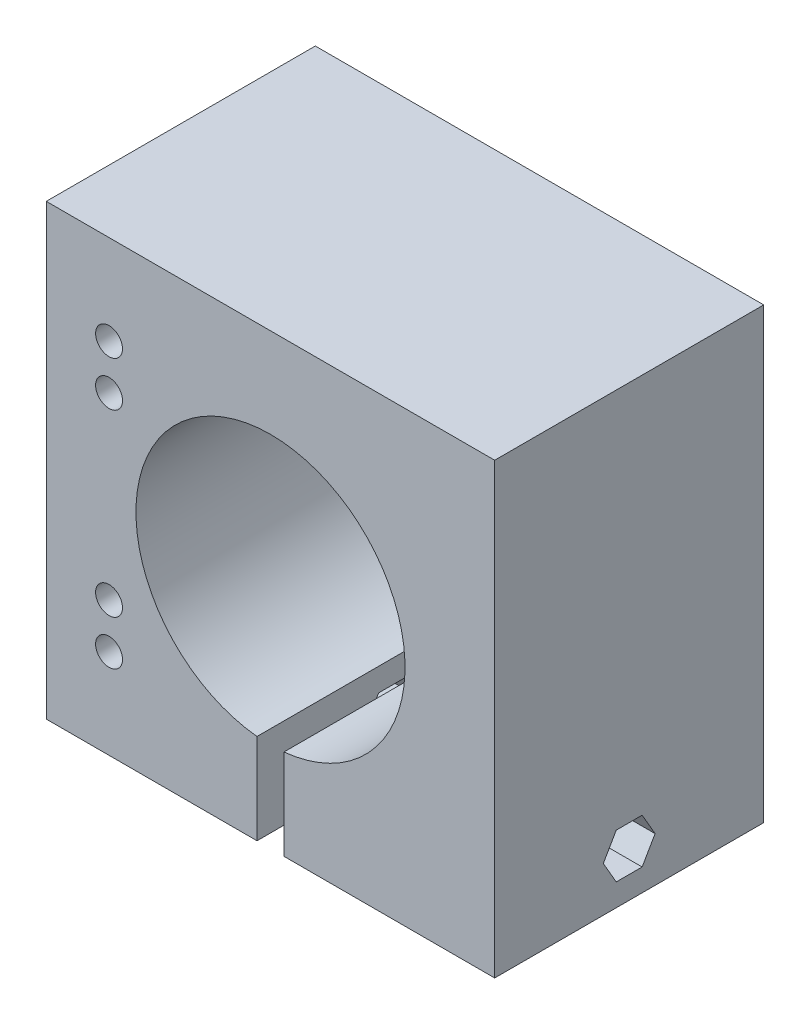
from build123d import *

# Parameters (mm, degrees)
SKETCH1_W           = 50
SKETCH1_H           = 50
SKETCH1_R           = 15
SKETCH1_R_2         = 1.5
BOSS_EXTRUDE1_DEPTH = 30
CUT_EXTRUDE1_REACH  = 78.811
SKETCH2_W           = 3
SKETCH2_H           = 11.709133009
CUT_EXTRUDE2_DEPTH  = 54
CUT_EXTRUDE3_DEPTH  = 5


with BuildPart() as part:
    # Sketch1 → Boss-Extrude1 (new body)
    with BuildSketch(Plane.XY):
        with Locations((25, 25)):
            Rectangle(SKETCH1_W, SKETCH1_H)
        with Locations((25, 25)):
            Circle(SKETCH1_R, mode=Mode.SUBTRACT)
        with Locations((7, 15)):
            Circle(SKETCH1_R_2, mode=Mode.SUBTRACT)
        with Locations((7, 40)):
            Circle(SKETCH1_R_2, mode=Mode.SUBTRACT)
        with Locations((7, 10)):
            Circle(SKETCH1_R_2, mode=Mode.SUBTRACT)
        with Locations((7, 35)):
            Circle(SKETCH1_R_2, mode=Mode.SUBTRACT)
    extrude(amount=BOSS_EXTRUDE1_DEPTH)

    # Sketch2 → Cut-Extrude1 (cut, up to next)
    with BuildSketch(Plane.XY.offset(30), mode=Mode.PRIVATE) as cut_extrude1_sk1:
        with Locations((25, 5.854566505)):
            Rectangle(SKETCH2_W, SKETCH2_H)
    cut_extrude1_tool1 = extrude(cut_extrude1_sk1.sketch, amount=-CUT_EXTRUDE1_REACH, mode=Mode.PRIVATE) & part.part
    add(cut_extrude1_tool1.solids().sort_by_distance((25, 5.854567, 30))[0], mode=Mode.SUBTRACT)

    # Sketch3 → Cut-Extrude2 (cut)
    with BuildSketch(Plane(origin=(50, 0, 0), x_dir=(0, 0, -1), z_dir=(1, 0, 0))):
        Polygon((-12.113248654, 5), (-13.556624327, 7.5), (-16.443375673, 7.5), (-17.886751346, 5), (-16.443375673, 2.5), (-13.556624327, 2.5), align=None)
    extrude(amount=-CUT_EXTRUDE2_DEPTH, mode=Mode.SUBTRACT)

    # Sketch4 → Cut-Extrude3 (cut)
    with BuildSketch(Plane.ZY):
        Polygon((19.618802154, 5), (17.309401077, 9), (12.690598923, 9), (10.381197846, 5), (12.690598923, 1), (17.309401077, 1), align=None)
    extrude(amount=-CUT_EXTRUDE3_DEPTH, mode=Mode.SUBTRACT)


solid = part.part
